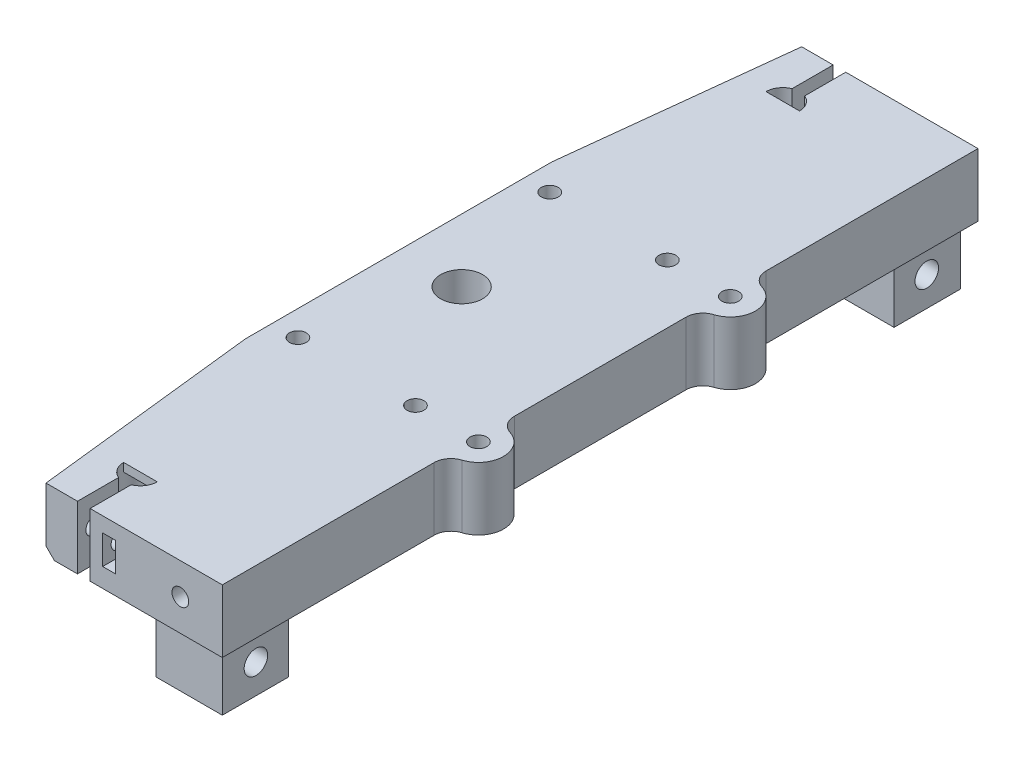
from build123d import *

# Parameters (mm, degrees)
SZKIC1_R                    = 5
SZKIC1_R_2                  = 2
DODANIE_WYCI_GNI_CIE1_DEPTH = 15
SZKIC2_W                    = 15.8
SZKIC2_H                    = 15.8
DODANIE_WYCI_GNI_CIE2_DEPTH = 14
DODANIE_WYCI_GNI_CIE3_START = -2
DODANIE_WYCI_GNI_CIE3_DEPTH = 2
DODANIE_WYCI_GNI_CIE4_DEPTH = 15
SZKIC5_R                    = 2
WYTNIJ_WYCI_GNI_CIE1_DEPTH  = 15
ZAOKR_GLENIE1_R             = 4
SFAZOWANIE1_SIZE            = 2
WYTNIJ_WYCI_GNI_CIE3_START  = -7
SZKIC8_R                    = 2
WYTNIJ_WYCI_GNI_CIE3_DEPTH  = 107.031560626
WYTNIJ_WYCI_GNI_CIE4_START  = 8
SZKIC9_R                    = 3.5
WYTNIJ_WYCI_GNI_CIE4_DEPTH  = 4
WYTNIJ_WYCI_GNI_CIE5_START  = -6
SZKIC10_R                   = 2
WYTNIJ_WYCI_GNI_CIE5_DEPTH  = 3
SZKIC11_R                   = 2
WYTNIJ_WYCI_GNI_CIE6_DEPTH  = 7
SZKIC12_R                   = 2.8
WYTNIJ_WYCI_GNI_CIE7_DEPTH  = 103.136232552


with BuildPart() as part:
    # Szkic1 → Dodanie-wyciągnięcie1 (new body)
    with BuildSketch(Plane(origin=(0, 0, 0), x_dir=(1, 0, 0), z_dir=(0, 1, 0))):
        with BuildLine():
            Line((-14.5, 90), (-20.5, 36.5))
            Line((-20.5, 36.5), (-20.5, -36.5))
            Line((-20.5, -36.5), (-14.5, -90))
            Line((-14.5, -90), (-7, -90))
            Line((-7, -90), (-7, -80.208099244))
            ThreePointArc((-7, -80.208099244), (-5.5, -72.5), (-4, -80.208099244))
            Line((-4, -80.208099244), (-4, -90))
            Line((-4, -90), (27.5, -90))
            Line((27.5, -90), (27.5, 90))
            Line((27.5, 90), (-3.999999674, 90))
            Line((-3.999999674, 90), (-4, 80.208099244))
            ThreePointArc((-4, 80.208099244), (-5.5, 72.5), (-7, 80.208099244))
            Line((-7, 80.208099244), (-6.999999674, 90))
            Line((-6.999999674, 90), (-14.5, 90))
        make_face()
        with Locations((-5.5, 0)):
            Circle(SZKIC1_R, mode=Mode.SUBTRACT)
        with Locations((-14.5, 30)):
            Circle(SZKIC1_R_2, mode=Mode.SUBTRACT)
        with Locations((13.5, 30)):
            Circle(SZKIC1_R_2, mode=Mode.SUBTRACT)
        with Locations((-14.5, -30)):
            Circle(SZKIC1_R_2, mode=Mode.SUBTRACT)
        with Locations((13.5, -30)):
            Circle(SZKIC1_R_2, mode=Mode.SUBTRACT)
    extrude(amount=DODANIE_WYCI_GNI_CIE1_DEPTH)

    # Szkic2 → Dodanie-wyciągnięcie2 (add)
    with BuildSketch(Plane.XZ):
        with Locations((17.5, -80)):
            Rectangle(SZKIC2_W, SZKIC2_H)
    dodanie_wyci_gni_cie2 = extrude(amount=DODANIE_WYCI_GNI_CIE2_DEPTH)

    # Lustro1: Dodanie-wyciągnięcie2 across plane
    add(dodanie_wyci_gni_cie2.mirror(Plane.XY))

    # Szkic3 → Dodanie-wyciągnięcie3 (add)
    with BuildSketch(Plane(origin=(0, 15, 0), x_dir=(1, 0, 0), z_dir=(0, 1, 0)).offset(DODANIE_WYCI_GNI_CIE3_START)):
        with BuildLine():
            Line((-1.5, 76.5), (-9.5, 76.5))
            ThreePointArc((-9.5, 76.5), (-5.5, 72.5), (-1.5, 76.5))
        make_face()
        with BuildLine():
            ThreePointArc((-1.5, -76.5), (-5.5, -72.5), (-9.5, -76.5))
            Line((-9.5, -76.5), (-1.5, -76.5))
        make_face()
    extrude(amount=DODANIE_WYCI_GNI_CIE3_DEPTH)

    # Szkic4 → Dodanie-wyciągnięcie4 (add)
    with BuildSketch(Plane(origin=(0, 15, 0), x_dir=(1, 0, 0), z_dir=(0, 1, 0))):
        with BuildLine():
            ThreePointArc((27.5, -28.267949192), (30.5, -30), (27.5, -31.732050808))
            Line((27.5, -31.732050808), (27.5, -35.916079783))
            ThreePointArc((27.5, -35.916079783), (34.5, -30), (27.5, -24.083920217))
            Line((27.5, -24.083920217), (27.5, -28.267949192))
        make_face()
        with BuildLine():
            Line((27.5, 28.267949192), (27.5, 24.083920217))
            ThreePointArc((27.5, 24.083920217), (34.5, 30), (27.5, 35.916079783))
            Line((27.5, 35.916079783), (27.5, 31.732050808))
            ThreePointArc((27.5, 31.732050808), (30.5, 30), (27.5, 28.267949192))
        make_face()
    extrude(amount=-DODANIE_WYCI_GNI_CIE4_DEPTH)

    # Szkic5 → Wytnij-wyciągnięcie1 (cut)
    with BuildSketch(Plane(origin=(0, 15, 0), x_dir=(1, 0, 0), z_dir=(0, 1, 0))):
        with Locations((28.5, 30)):
            Circle(SZKIC5_R)
        with Locations((28.5, -30)):
            Circle(SZKIC5_R)
    extrude(amount=-WYTNIJ_WYCI_GNI_CIE1_DEPTH, mode=Mode.SUBTRACT)

    # Zaokrąglenie1
    zaokr_glenie1_edges = [part.edges().sort_by_distance(p)[0] for p in [
        (27.5, 7.5, -35.916079783),
        (27.5, 7.5, -24.083920217),
        (27.5, 7.5, 24.083920217),
        (27.5, 7.5, 35.916079783),
    ]]
    fillet(zaokr_glenie1_edges, radius=ZAOKR_GLENIE1_R)

    # Sfazowanie1
    sfazowanie1_edges = [part.edges().sort_by_distance(p)[0] for p in [
        (-17.5, 0, -63.25),
        (-17.5, 0, 63.25),
        (-20.5, 0, 0),
    ]]
    chamfer(sfazowanie1_edges, length=SFAZOWANIE1_SIZE)

    # Szkic8 → Wytnij-wyciągnięcie3 (cut)
    with BuildSketch(Plane.ZY.offset(4).offset(WYTNIJ_WYCI_GNI_CIE3_START)):
        with Locations((86, 8)):
            Circle(SZKIC8_R)
    wytnij_wyci_gni_cie3 = extrude(amount=WYTNIJ_WYCI_GNI_CIE3_DEPTH, mode=Mode.SUBTRACT)

    # Szkic9 → Wytnij-wyciągnięcie4 (cut)
    with BuildSketch(Plane.ZY.offset(4).offset(WYTNIJ_WYCI_GNI_CIE4_START)):
        with Locations((86, 8)):
            Circle(SZKIC9_R)
    wytnij_wyci_gni_cie4 = extrude(amount=WYTNIJ_WYCI_GNI_CIE4_DEPTH, mode=Mode.SUBTRACT)

    # Szkic10 → Wytnij-wyciągnięcie5 (cut)
    with BuildSketch(Plane.ZY.offset(4).offset(WYTNIJ_WYCI_GNI_CIE5_START)):
        Polygon((83, 6.267949192), (86, 4.535898385), (90, 4.535898385), (90, 11.464101615), (86, 11.464101615), (83, 9.732050808), align=None)
        with Locations((86, 8)):
            Circle(SZKIC10_R, mode=Mode.SUBTRACT)
    wytnij_wyci_gni_cie5 = extrude(amount=WYTNIJ_WYCI_GNI_CIE5_DEPTH, mode=Mode.SUBTRACT)

    # Lustro2: Wytnij-wyciągnięcie3, Wytnij-wyciągnięcie4, Wytnij-wyciągnięcie5 across plane
    add(wytnij_wyci_gni_cie3.mirror(Plane.XY), mode=Mode.SUBTRACT)
    add(wytnij_wyci_gni_cie4.mirror(Plane.XY), mode=Mode.SUBTRACT)
    add(wytnij_wyci_gni_cie5.mirror(Plane.XY), mode=Mode.SUBTRACT)

    # Szkic11 → Wytnij-wyciągnięcie6 (cut)
    with BuildSketch(Plane.XY.offset(90)):
        with Locations((17.5, 7.5)):
            Circle(SZKIC11_R)
    wytnij_wyci_gni_cie6 = extrude(amount=-WYTNIJ_WYCI_GNI_CIE6_DEPTH, mode=Mode.SUBTRACT)

    # Lustro3: Wytnij-wyciągnięcie6 across plane
    add(wytnij_wyci_gni_cie6.mirror(Plane.XY), mode=Mode.SUBTRACT)

    # Szkic12 → Wytnij-wyciągnięcie7 (cut, through all)
    with BuildSketch(Plane(origin=(25.4, 0, 0), x_dir=(0, 0, -1), z_dir=(1, 0, 0))):
        with Locations((-79.9, -7)):
            Circle(SZKIC12_R)
        with Locations((79.9, -7)):
            Circle(SZKIC12_R)
    extrude(amount=-WYTNIJ_WYCI_GNI_CIE7_DEPTH, mode=Mode.SUBTRACT)


solid = part.part
